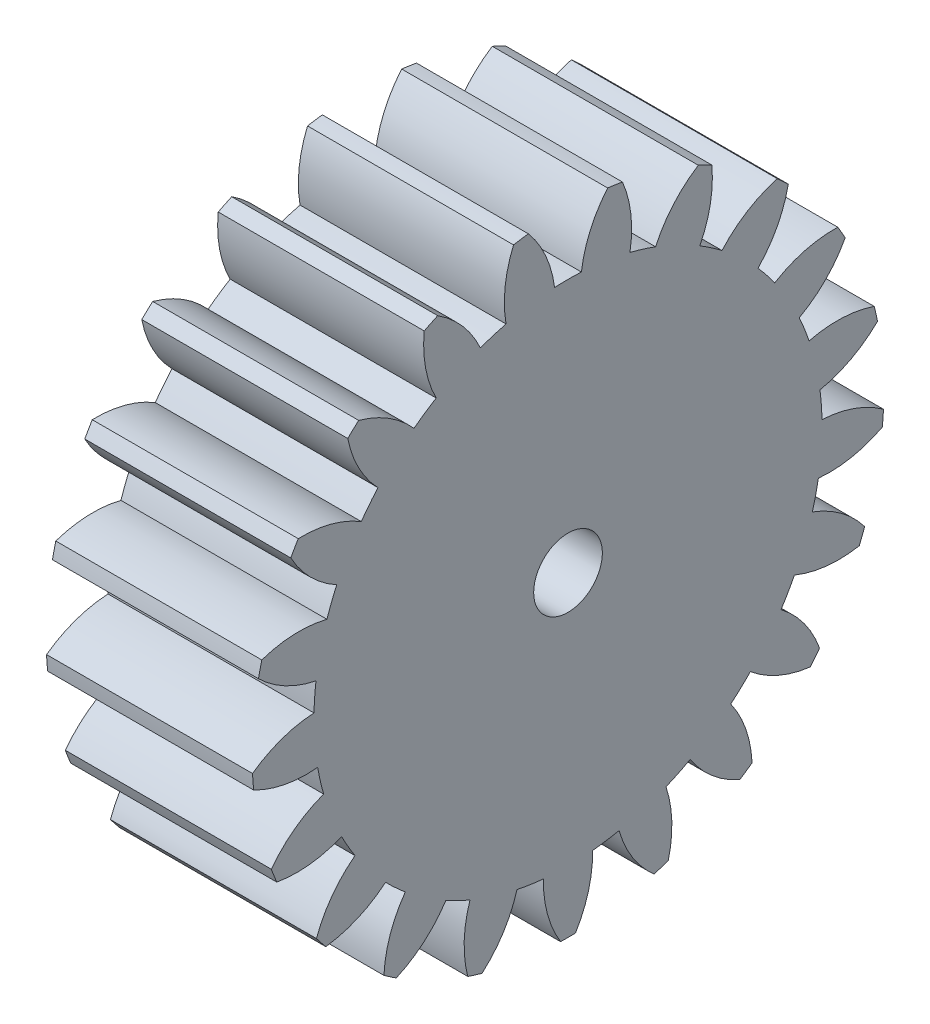
from build123d import *

# Parameters (mm, degrees)
BASPROSKE_W     = 15
BASPROSKE_H     = 23
TOOTHCUT_DEPTH  = 36.818989377
TEETHCUTS_COUNT = 21
TEETHCUTS_ANGLE = 342.857142857
BORSKE_R        = 2.5
BORE_DEPTH      = 50.0000508


with BuildPart() as part:
    # BasProSke → Base-Revolve (revolve)
    with BuildSketch(Plane(origin=(0, 0, 0), x_dir=(1, 0, 0), z_dir=(0, 1, 0))):
        with Locations((7.5, 11.5)):
            Rectangle(BASPROSKE_W, BASPROSKE_H)
    revolve(axis=Axis((-10, 0, 0), (1, 0, 0)))

    # TooCutSke → ToothCut (cut, through all)
    with BuildSketch(Plane(origin=(0, 0, 0), x_dir=(0, 0, -1), z_dir=(1, 0, 0))):
        with BuildLine():
            ThreePointArc((0.976779145, 18.473194188), (0, 18.499), (-0.976779145, 18.473194188))
            ThreePointArc((-0.976779145, 18.473194188), (-1.625451341, 20.797249275), (-2.90802115, 22.841025768))
            ThreePointArc((-2.90802115, 22.841025768), (0, 23.0254), (2.90802115, 22.841025768))
            ThreePointArc((2.90802115, 22.841025768), (1.625451341, 20.797249275), (0.976779145, 18.473194188))
        make_face()
    toothcut = extrude(amount=TOOTHCUT_DEPTH, mode=Mode.SUBTRACT)

    # TeethCuts: ToothCut ×21 about axis
    teethcuts_axis = Axis((-10, 0, 0), (1, 0, 0))
    for i in range(1, TEETHCUTS_COUNT):
        add(toothcut.rotate(teethcuts_axis, i * TEETHCUTS_ANGLE / (TEETHCUTS_COUNT - 1)), mode=Mode.SUBTRACT)

    # BorSke → Bore (cut, symmetric)
    with BuildSketch(Plane(origin=(0, 0, 0), x_dir=(0, 0, -1), z_dir=(1, 0, 0))):
        Circle(BORSKE_R)
    extrude(amount=BORE_DEPTH, both=True, mode=Mode.SUBTRACT)


solid = part.part
